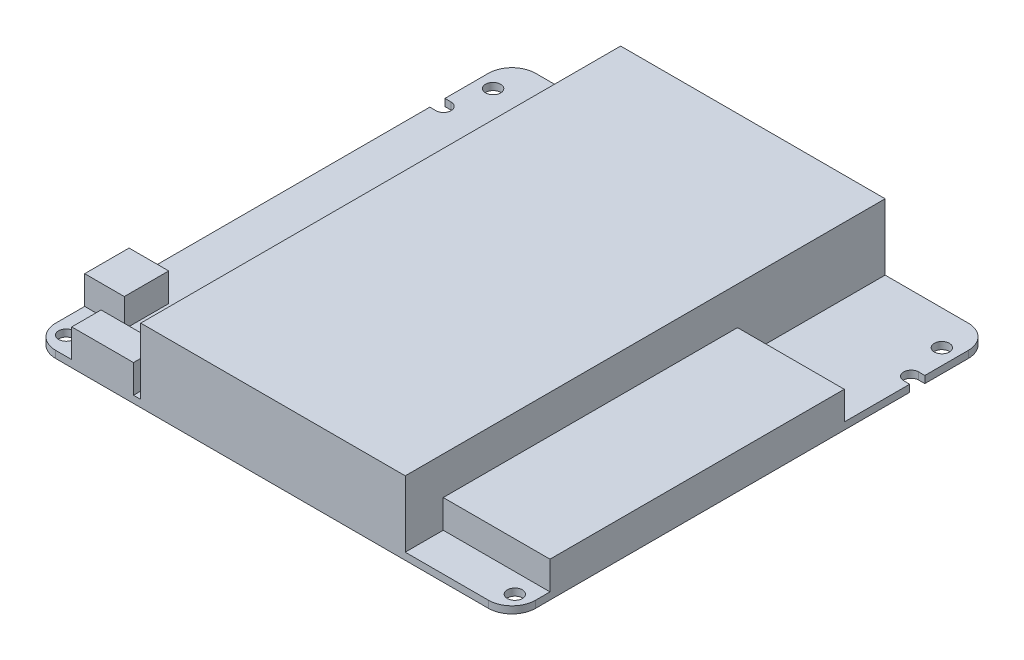
from build123d import *

# Parameters (mm, degrees)
SKETCH_1_R      = 1.6
EXTRUDE_1_DEPTH = 1.5
SKETCH_2_W      = 56
SKETCH_2_H      = 101.6
EXTRUDE_2_DEPTH = 14
SKETCH_3_W      = 22.6
SKETCH_3_H      = 62.30419098
SKETCH_3_W_2    = 13.073006245
SKETCH_3_H_2    = 6.218410599
SKETCH_3_W_3    = 8.391210828
SKETCH_3_H_3    = 9.399534429
EXTRUDE_3_DEPTH = 6
SKETCH_4_W      = 6
SKETCH_4_H      = 11.3
EXTRUDE_4_DEPTH = 13.4


with BuildPart() as part:
    # Эскиз1 → Бобышка-Вытянуть1 (new body)
    with BuildSketch(Plane(origin=(0, 0, 0), x_dir=(1, 0, 0), z_dir=(0, 1, 0))):
        with BuildLine():
            Line((45.8, 50.8), (-45.8, 50.8))
            ThreePointArc((-45.8, 50.8), (-49.335533906, 49.335533906), (-50.8, 45.8))
            Line((-50.8, 45.8), (-50.8, 36.6))
            Line((-50.8, 36.6), (-49.5, 36.6))
            ThreePointArc((-49.5, 36.6), (-47.9, 35), (-49.5, 33.4))
            Line((-49.5, 33.4), (-50.8, 33.4))
            Line((-50.8, 33.4), (-50.8, -45.8))
            ThreePointArc((-50.8, -45.8), (-49.335533906, -49.335533906), (-45.8, -50.8))
            Line((-45.8, -50.8), (45.8, -50.8))
            ThreePointArc((45.8, -50.8), (49.335533906, -49.335533906), (50.8, -45.8))
            Line((50.8, -45.8), (50.8, 33.4))
            Line((50.8, 33.4), (49.5, 33.4))
            ThreePointArc((49.5, 33.4), (47.9, 35), (49.5, 36.6))
            Line((49.5, 36.6), (50.8, 36.6))
            Line((50.8, 36.6), (50.8, 45.8))
            ThreePointArc((50.8, 45.8), (49.335533906, 49.335533906), (45.8, 50.8))
        make_face()
        with Locations((-47.5, -46.9)):
            Circle(SKETCH_1_R, mode=Mode.SUBTRACT)
        with Locations((47.5, -46.9)):
            Circle(SKETCH_1_R, mode=Mode.SUBTRACT)
        with Locations((-47.5, 43.5)):
            Circle(SKETCH_1_R, mode=Mode.SUBTRACT)
        with Locations((47.5, 43.5)):
            Circle(SKETCH_1_R, mode=Mode.SUBTRACT)
    extrude(amount=EXTRUDE_1_DEPTH)

    # Эскиз2 → Бобышка-Вытянуть2 (add)
    with BuildSketch(Plane(origin=(0, 1.5, 0), x_dir=(1, 0, 0), z_dir=(0, 1, 0))):
        with Locations((0.2, 0)):
            Rectangle(SKETCH_2_W, SKETCH_2_H)
    extrude(amount=EXTRUDE_2_DEPTH)

    # Эскиз3 → Бобышка-Вытянуть3 (add)
    with BuildSketch(Plane(origin=(0, 1.5, 0), x_dir=(1, 0, 0), z_dir=(0, 1, 0))):
        with Locations((39.5, -11.607082664)):
            Rectangle(SKETCH_3_W, SKETCH_3_H)
        with Locations((-35.87228605, -47.690794701)):
            Rectangle(SKETCH_3_W_2, SKETCH_3_H_2)
        with Locations((-46.604394586, -34.970831235)):
            Rectangle(SKETCH_3_W_3, SKETCH_3_H_3)
    extrude(amount=EXTRUDE_3_DEPTH)

    # Эскиз4 → Бобышка-Вытянуть4 (add)
    with BuildSketch(Plane.XZ):
        with Locations((27.8, -45.15)):
            Rectangle(SKETCH_4_W, SKETCH_4_H)
    extrude(amount=EXTRUDE_4_DEPTH)


solid = part.part
